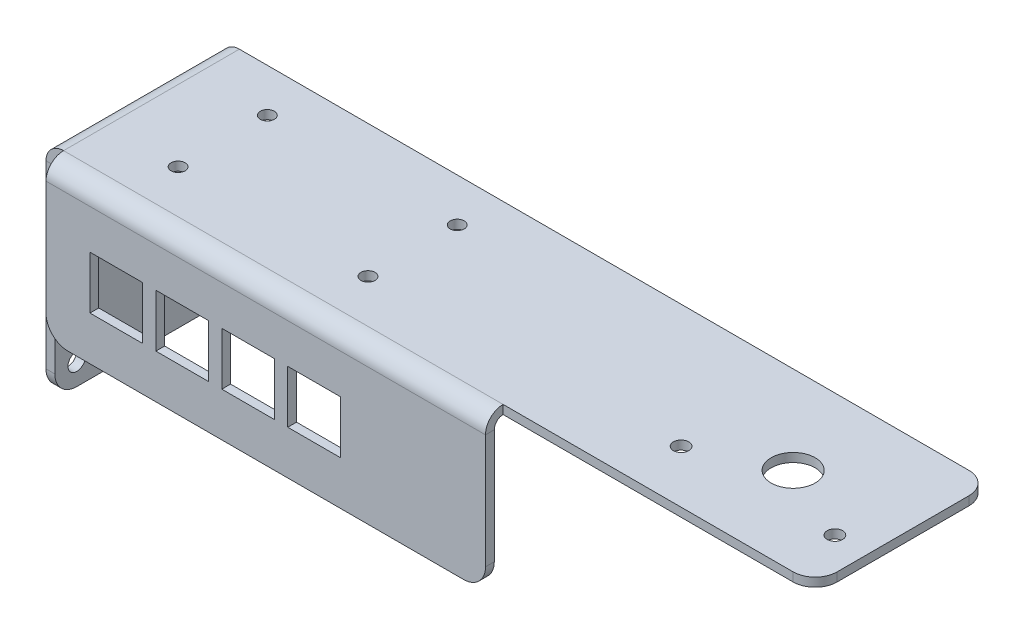
from build123d import *

# Parameters (mm, degrees)
BASE_FLANGE1_DEPTH = 40
SKETCH6_R          = 2
CUT_EXTRUDE1_DEPTH = 10
SKETCH7_R          = 5
SKETCH7_R_2        = 1.75
CUT_EXTRUDE2_DEPTH = 10
SKETCH8_R          = 1.6
CUT_EXTRUDE3_DEPTH = 10
EDGE_FLANGE1_DEPTH = 100
FILLET1_R          = 5
SKETCH12_W         = 12
SKETCH12_H         = 12
CUT_EXTRUDE4_DEPTH = 10


# Sheet-metal steps are written as plain solids
with BuildPart() as part:
    # Sketch1 → Base-Flange1 (new body)
    with BuildSketch(Plane.XY):
        with BuildLine():
            Line((0, 0), (0, 46))
            ThreePointArc((0, 46), (1.171572875, 48.828427125), (4, 50))
            Line((4, 50), (175, 50))
            Line((175, 50), (175, 48))
            Line((175, 48), (4, 48))
            ThreePointArc((4, 48), (2.585786438, 47.414213562), (2, 46))
            Line((2, 46), (2, 0))
            Line((2, 0), (0, 0))
        make_face()
    extrude(amount=BASE_FLANGE1_DEPTH)

    # Sketch6 → Cut-Extrude1 (cut)
    with BuildSketch(Plane.ZY):
        with Locations((5, 41)):
            Circle(SKETCH6_R)
        with Locations((35, 5)):
            Circle(SKETCH6_R)
    extrude(amount=-CUT_EXTRUDE1_DEPTH, mode=Mode.SUBTRACT)

    # Sketch7 → Cut-Extrude2 (cut)
    with BuildSketch(Plane(origin=(0, 50, 0), x_dir=(1, 0, 0), z_dir=(0, 1, 0))):
        with Locations(Location((150, -20, 0), (0, 0, 270))):
            Circle(SKETCH7_R)
        with Locations(Location((132.5, -28, 0), (0, 0, 270))):
            Circle(SKETCH7_R_2)
        with Locations(Location((167.5, -28, 0), (0, 0, 270))):
            Circle(SKETCH7_R_2)
    extrude(amount=-CUT_EXTRUDE2_DEPTH, mode=Mode.SUBTRACT)

    # Sketch8 → Cut-Extrude3 (cut)
    with BuildSketch(Plane(origin=(0, 50, 0), x_dir=(1, 0, 0), z_dir=(0, 1, 0))):
        with Locations(Location((20.208399829, -9.85, 0), (0, 0, 270))):
            Circle(SKETCH8_R)
        with Locations(Location((63.408399829, -9.85, 0), (0, 0, 270))):
            Circle(SKETCH8_R)
        with Locations(Location((63.408399829, -30.15, 0), (0, 0, 270))):
            Circle(SKETCH8_R)
        with Locations(Location((20.208399829, -30.15, 0), (0, 0, 270))):
            Circle(SKETCH8_R)
    extrude(amount=-CUT_EXTRUDE3_DEPTH, mode=Mode.SUBTRACT)

    # Edge-Flange1 section (across the edge) → Edge-Flange1 (add)
    with BuildSketch(Plane(origin=(104, 48, 42), x_dir=(0, 0, -1), z_dir=(-1, 0, 0))):
        with BuildLine():
            Line((-2, 2), (-2, 33))
            Line((-2, 33), (0, 33))
            Line((0, 33), (0, 2))
            ThreePointArc((0, 2), (0.585786438, 0.585786438), (2, 0))
            Line((2, 0), (2, -2))
            ThreePointArc((2, -2), (-0.828427125, -0.828427125), (-2, 2))
        make_face()
    extrude(amount=EDGE_FLANGE1_DEPTH)

    # Fillet1
    fillet1_edges = [part.edges().sort_by_distance(p)[0] for p in [
        (104, 15, 43),
        (4, 15, 43),
        (1, 0, 40),
        (175, 49, 40),
        (1, 0, 0),
        (175, 49, 0),
    ]]
    fillet(fillet1_edges, radius=FILLET1_R)

    # Sketch12 → Cut-Extrude4 (cut)
    with BuildSketch(Plane.XY.offset(44)):
        with Locations((20, 31)):
            Rectangle(SKETCH12_W, SKETCH12_H)
        with Locations((35, 31)):
            Rectangle(SKETCH12_W, SKETCH12_H)
        with Locations((50, 31)):
            Rectangle(SKETCH12_W, SKETCH12_H)
        with Locations((65, 31)):
            Rectangle(SKETCH12_W, SKETCH12_H)
    extrude(amount=-CUT_EXTRUDE4_DEPTH, mode=Mode.SUBTRACT)


solid = part.part
